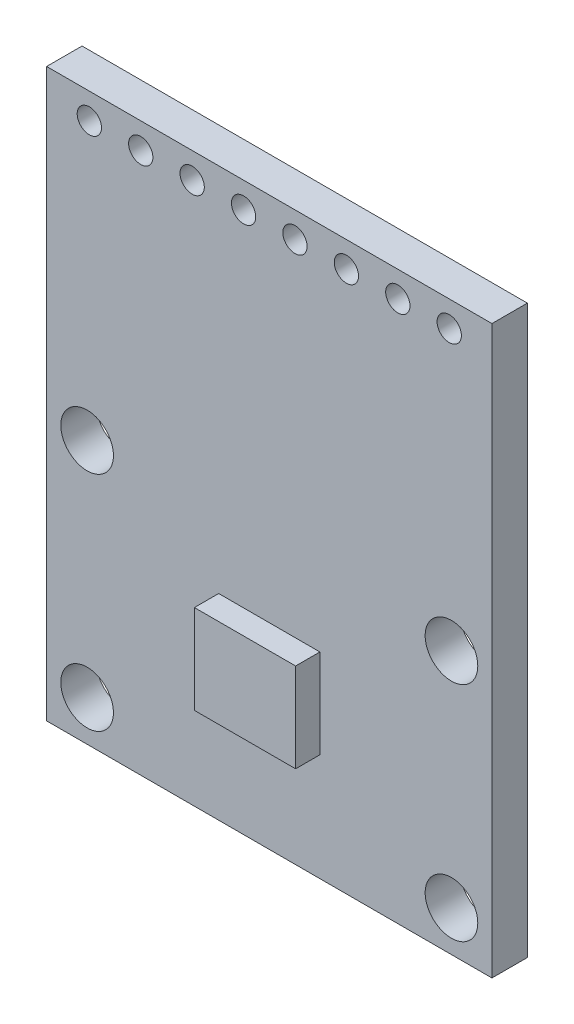
from build123d import *

# Parameters (mm, degrees)
SKETCH1_W               = 22
SKETCH1_H               = 28
BOSS_EXTRUDE1_DEPTH     = 1.75
SKETCH2_R               = 1.3
SKETCH2_R_2             = 1
CUT_EXTRUDE1_DEPTH      = 18.890290663
SKETCH3_R               = 0.6
CUT_EXTRUDE2_DEPTH      = 18.890290663
LPATTERN1_COUNT         = 4
LPATTERN1_PITCH         = 2.54
MIRROR1_COPY_1_SKETCH_R = 0.6
MIRROR1_COPY_1_DEPTH    = 18.890290663
MIRROR1_COPY_2_SKETCH_R = 0.6
MIRROR1_COPY_2_DEPTH    = 18.890290663
MIRROR1_COPY_3_SKETCH_R = 0.6
MIRROR1_COPY_3_DEPTH    = 18.890290663
MIRROR1_COPY_4_SKETCH_R = 0.6
MIRROR1_COPY_4_DEPTH    = 18.890290663
SKETCH4_W               = 5
SKETCH4_H               = 4.4
BOSS_EXTRUDE2_DEPTH     = 1.2


with BuildPart() as part:
    # Sketch1 → Boss-Extrude1 (new body)
    with BuildSketch(Plane.XY):
        Rectangle(SKETCH1_W, SKETCH1_H)
    extrude(amount=BOSS_EXTRUDE1_DEPTH)

    # Sketch2 → Cut-Extrude1 (cut, through all)
    with BuildSketch(Plane.XY.offset(1.75)):
        with Locations((-9, -1)):
            Circle(SKETCH2_R)
        with Locations((-9, -12)):
            Circle(SKETCH2_R)
        with Locations((9, -12)):
            Circle(SKETCH2_R)
        with Locations((9, -1)):
            Circle(SKETCH2_R)
        with Locations((0, -6.5)):
            Circle(SKETCH2_R_2)
    extrude(amount=-CUT_EXTRUDE1_DEPTH, mode=Mode.SUBTRACT)

    # Sketch3 → Cut-Extrude2 (cut, through all)
    with BuildSketch(Plane.XY.offset(1.75)):
        with Locations((-1.27, 12.73)):
            Circle(SKETCH3_R)
    cut_extrude2 = extrude(amount=-CUT_EXTRUDE2_DEPTH, mode=Mode.SUBTRACT)

    # LPattern1: Cut-Extrude2 ×4
    with Locations(*[(-i * LPATTERN1_PITCH, 0, 0) for i in range(1, LPATTERN1_COUNT)]):
        add(cut_extrude2, mode=Mode.SUBTRACT)

    # Mirror1 copy 1 sketch → Mirror1 copy 1 (cut, through all)
    with BuildSketch(Plane(origin=(2.54, 0, 1.75), x_dir=(-1, 0, 0), z_dir=(0, 0, 1))):
        with Locations((-1.27, -12.73)):
            Circle(MIRROR1_COPY_1_SKETCH_R)
    extrude(amount=-MIRROR1_COPY_1_DEPTH, mode=Mode.SUBTRACT)

    # Mirror1 copy 2 sketch → Mirror1 copy 2 (cut, through all)
    with BuildSketch(Plane(origin=(5.08, 0, 1.75), x_dir=(-1, 0, 0), z_dir=(0, 0, 1))):
        with Locations((-1.27, -12.73)):
            Circle(MIRROR1_COPY_2_SKETCH_R)
    extrude(amount=-MIRROR1_COPY_2_DEPTH, mode=Mode.SUBTRACT)

    # Mirror1 copy 3 sketch → Mirror1 copy 3 (cut, through all)
    with BuildSketch(Plane(origin=(7.62, 0, 1.75), x_dir=(-1, 0, 0), z_dir=(0, 0, 1))):
        with Locations((-1.27, -12.73)):
            Circle(MIRROR1_COPY_3_SKETCH_R)
    extrude(amount=-MIRROR1_COPY_3_DEPTH, mode=Mode.SUBTRACT)

    # Mirror1 copy 4 sketch → Mirror1 copy 4 (cut, through all)
    with BuildSketch(Plane(origin=(0, 0, 1.75), x_dir=(-1, 0, 0), z_dir=(0, 0, 1))):
        with Locations((-1.27, -12.73)):
            Circle(MIRROR1_COPY_4_SKETCH_R)
    extrude(amount=-MIRROR1_COPY_4_DEPTH, mode=Mode.SUBTRACT)

    # Sketch4 → Boss-Extrude2 (add)
    with BuildSketch(Plane.XY.offset(1.75)):
        with Locations((0, -6.5)):
            Rectangle(SKETCH4_W, SKETCH4_H)
    extrude(amount=BOSS_EXTRUDE2_DEPTH)


solid = part.part
